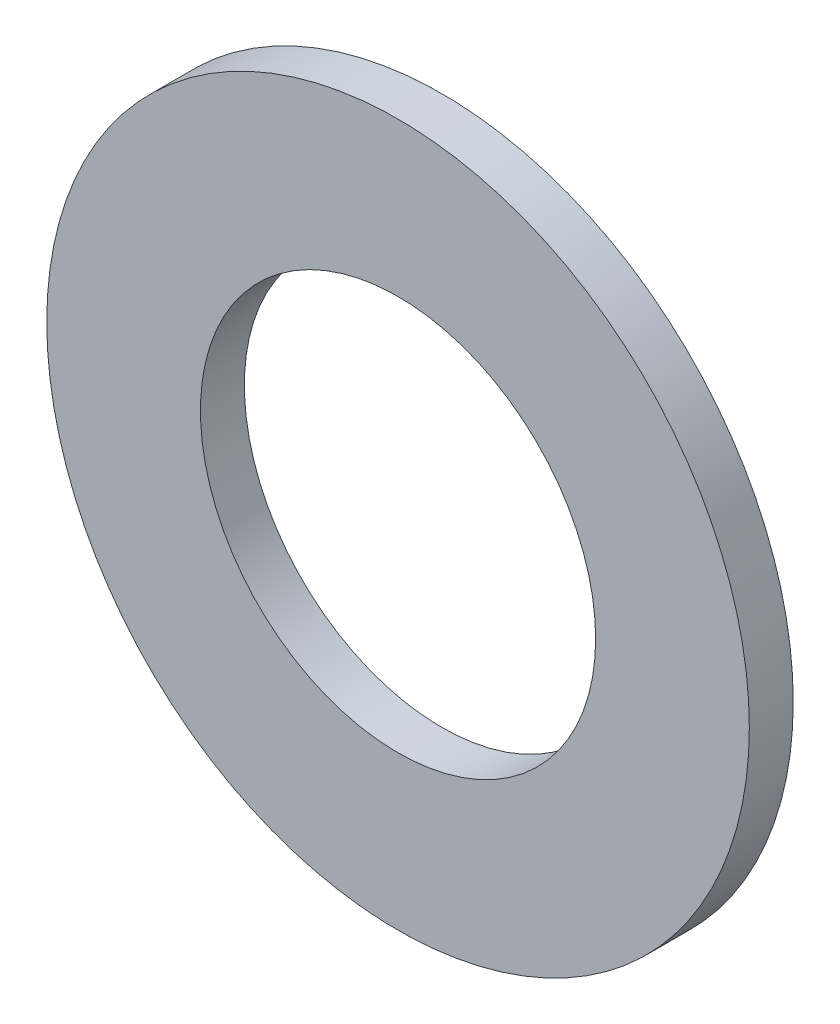
from build123d import *

# Parameters (mm, degrees)
SKETCH1_R          = 8
BASE_FLANGE1_DEPTH = 1
SKETCH6_R          = 4.5
CUT_EXTRUDE1_DEPTH = 12.357816692


# Sheet-metal steps are written as plain solids
with BuildPart() as part:
    # Sketch1 → Base-Flange1 (new body)
    with BuildSketch(Plane.XY):
        Circle(SKETCH1_R)
    extrude(amount=-BASE_FLANGE1_DEPTH)

    # Sketch6 → Cut-Extrude1 (cut, through all)
    with BuildSketch(Plane.XY):
        Circle(SKETCH6_R)
    extrude(amount=-CUT_EXTRUDE1_DEPTH, mode=Mode.SUBTRACT)


solid = part.part
